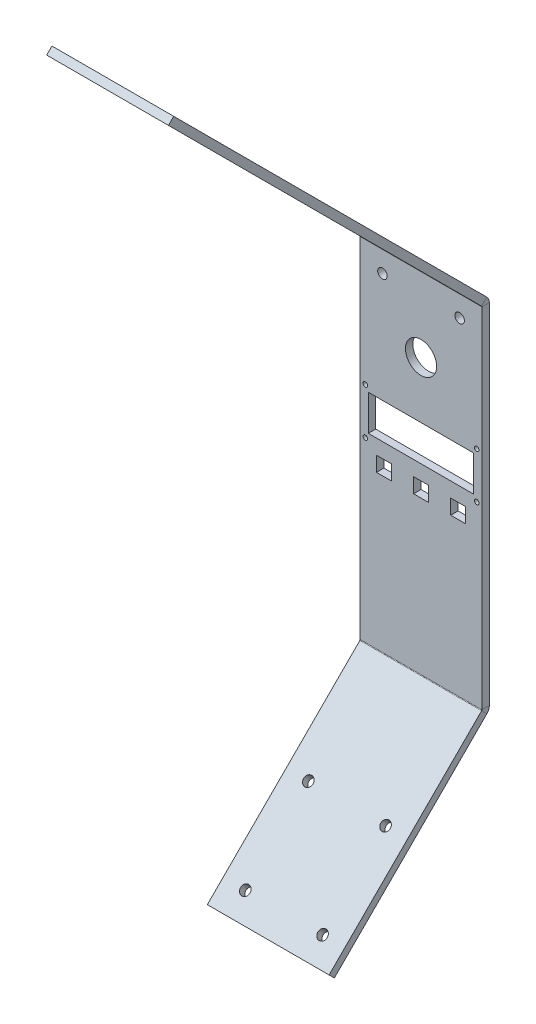
from build123d import *

# Parameters (mm, degrees)
SKETCH1_W                = 82
SKETCH1_H                = 683.5
BASE_FLANGE1_DEPTH       = 5
SKETCHED_START           = -41
SKETCHED_BEND1_DEPTH     = 82
SKETCHED_BEND1_2_DEPTH   = 82
M6_CLEARANCE_HOLE1_D     = 6.4
M6_CLEARANCE_HOLE1_DEPTH = 5
M6_CLEARANCE_HOLE1_TIP   = 1.922753981
SKETCH8_R                = 10.5
CUT_EXTRUDE1_DEPTH       = 373.579466057
SKETCH9_R                = 1.55
SKETCH9_W                = 71
SKETCH9_H                = 24
SKETCH9_W_2              = 10
SKETCH9_H_2              = 10
CUT_EXTRUDE2_DEPTH       = 373.579466057
M6_CLEARANCE_HOLE3_D     = 6.4
M6_CLEARANCE_HOLE3_DEPTH = 5
M6_CLEARANCE_HOLE3_TIP   = 1.922753981
M6_CLEARANCE_HOLE4_D     = 6.4
M6_CLEARANCE_HOLE4_DEPTH = 5
M6_CLEARANCE_HOLE4_TIP   = 1.922753981


# Read off the part's stored shape, not the designer's step: Sketched Bend1
# Sheet-metal steps are written as plain solids
with BuildPart() as part:
    # Sketch1 → Base-Flange1 (new body)
    with BuildSketch(Plane.XY):
        Rectangle(SKETCH1_W, SKETCH1_H)
    extrude(amount=-BASE_FLANGE1_DEPTH)

    # Sketched Bend1 outline → Sketched Bend1 (cut)
    with BuildSketch(Plane.YZ.offset(SKETCHED_START)):
        with BuildLine():
            Line((-341.75, -5), (-193.978990152, -5))
            ThreePointArc((-193.978990152, -5), (-196.17429193, -4.563327326), (-198.035378913, -3.319788761))
            Line((-198.035378913, -3.319788761), (-201.355167674, 0))
            Line((-201.355167674, 0), (-341.75, 0))
            Line((-341.75, 0), (-341.75, -5))
        make_face()
        with BuildLine():
            ThreePointArc((45.035378913, -3.319788761), (43.17429193, -4.563327326), (40.978990152, -5))
            Line((40.978990152, -5), (341.75, -5))
            Line((341.75, -5), (341.75, 0))
            Line((341.75, 0), (48.355167674, 0))
            Line((48.355167674, 0), (45.035378913, -3.319788761))
        make_face()
    extrude(amount=SKETCHED_BEND1_DEPTH, mode=Mode.SUBTRACT)

    # Sketched Bend1 2 outline → Sketched Bend1 2 (add)
    with BuildSketch(Plane.YZ.offset(SKETCHED_START)):
        with BuildLine():
            Line((-300.727782675, 99.372615001), (-201.355167674, 0))
            Line((-201.355167674, 0), (-193.978990152, 0))
            ThreePointArc((-193.978990152, 0), (-194.260874768, 0.056070336), (-194.499845007, 0.215745145))
            Line((-194.499845007, 0.215745145), (-297.192248769, 102.908148906))
            Line((-297.192248769, 102.908148906), (-300.727782675, 99.372615001))
        make_face()
        with BuildLine():
            Line((40.978990152, 0), (48.355167674, 0))
            Line((48.355167674, 0), (255.915120196, 207.559952522))
            Line((255.915120196, 207.559952522), (252.37958629, 211.095486428))
            Line((252.37958629, 211.095486428), (41.499845007, 0.215745145))
            ThreePointArc((41.499845007, 0.215745145), (41.260874768, 0.056070336), (40.978990152, 0))
        make_face()
    extrude(amount=SKETCHED_BEND1_2_DEPTH)

    # M6 Clearance Hole1
    with Locations(Plane(origin=(0, 0, -5), x_dir=(-1, 0, 0), z_dir=(0, 0, -1))):
        with Locations((-26, 26.978990152), (26, 26.978990152)):
            Hole(M6_CLEARANCE_HOLE1_D / 2, depth=M6_CLEARANCE_HOLE1_DEPTH)
            with Locations((0, 0, -(M6_CLEARANCE_HOLE1_DEPTH + M6_CLEARANCE_HOLE1_TIP / 2))):  # 118° drill point
                Cone(0, M6_CLEARANCE_HOLE1_D / 2, M6_CLEARANCE_HOLE1_TIP, mode=Mode.SUBTRACT)

    # Sketch8 → Cut-Extrude1 (cut, through all)
    with BuildSketch(Plane(origin=(0, 0, -5), x_dir=(-1, 0, 0), z_dir=(0, 0, -1))):
        with Locations((0, -9.021009848)):
            Circle(SKETCH8_R)
    extrude(amount=-CUT_EXTRUDE1_DEPTH, mode=Mode.SUBTRACT)

    # Sketch9 → Cut-Extrude2 (cut, through all)
    with BuildSketch(Plane(origin=(0, 0, -5), x_dir=(-1, 0, 0), z_dir=(0, 0, -1))):
        with Locations((-37.5, -43.521009848)):
            Circle(SKETCH9_R)
        with Locations((-37.5, -74.521009848)):
            Circle(SKETCH9_R)
        with Locations((37.5, -74.521009848)):
            Circle(SKETCH9_R)
        with Locations((37.5, -43.521009848)):
            Circle(SKETCH9_R)
        with Locations((0, -59.021009848)):
            Rectangle(SKETCH9_W, SKETCH9_H)
        with Locations((0, -86.021009848)):
            Rectangle(SKETCH9_W_2, SKETCH9_H_2)
        with Locations((-25, -86.021009848)):
            Rectangle(SKETCH9_W_2, SKETCH9_H_2)
        with Locations((25, -86.021009848)):
            Rectangle(SKETCH9_W_2, SKETCH9_H_2)
    extrude(amount=-CUT_EXTRUDE2_DEPTH, mode=Mode.SUBTRACT)

    # M6 Clearance Hole3
    with Locations(Plane(origin=(0, -100.677583837, -100.677583837), x_dir=(-1, 0, 0), z_dir=(0, -0.7071067811865487, -0.7071067811865465))):
        with Locations((-26, -207.913704352), (26, -207.913704352), (26, -267.913704352), (-26, -267.913704352)):
            Hole(M6_CLEARANCE_HOLE3_D / 2, depth=M6_CLEARANCE_HOLE3_DEPTH)
            with Locations((0, 0, -(M6_CLEARANCE_HOLE3_DEPTH + M6_CLEARANCE_HOLE3_TIP / 2))):  # 118° drill point
                Cone(0, M6_CLEARANCE_HOLE3_D / 2, M6_CLEARANCE_HOLE3_TIP, mode=Mode.SUBTRACT)

    # M6 Clearance Hole4
    with Locations(Plane(origin=(0, 24.177583837, -24.177583837), x_dir=(1, 0, 0), z_dir=(0, 0.7071067811865487, -0.7071067811865465))):
        with Locations((-26, -307.72636683), (26, -307.72636683)):
            Hole(M6_CLEARANCE_HOLE4_D / 2, depth=M6_CLEARANCE_HOLE4_DEPTH)
            with Locations((0, 0, -(M6_CLEARANCE_HOLE4_DEPTH + M6_CLEARANCE_HOLE4_TIP / 2))):  # 118° drill point
                Cone(0, M6_CLEARANCE_HOLE4_D / 2, M6_CLEARANCE_HOLE4_TIP, mode=Mode.SUBTRACT)


solid = part.part
